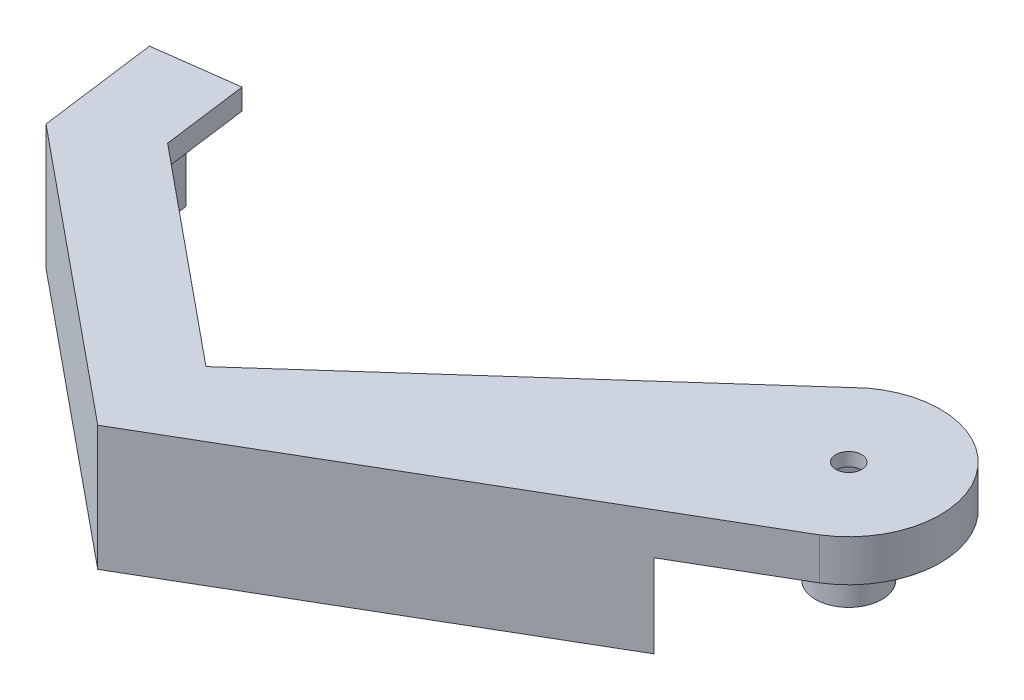
from build123d import *

# Parameters (mm, degrees)
SKETCH1_R           = 10.33488188
BOSS_EXTRUDE1_DEPTH = 4
MOVE_FACE1_BY       = 3
BOSS_EXTRUDE3_DEPTH = 5
SKETCH6_R           = 6.3
BOSS_EXTRUDE4_DEPTH = 0.3
MOVE_FACE2_BY       = 1
BOSS_EXTRUDE5_DEPTH = 10
CUT_EXTRUDE3_START  = -2.5
CUT_EXTRUDE3_DEPTH  = 2.5
SKETCH11_W          = 38.556462408
SKETCH11_H          = 5
CUT_EXTRUDE4_DEPTH  = 22
SKETCH12_W          = 43.724305207
SKETCH12_H          = 11.25792899
CUT_EXTRUDE5_DEPTH  = 23
SKETCH13_R          = 4
BOSS_EXTRUDE6_DEPTH = 7
SKETCH14_R          = 1.55
CUT_EXTRUDE6_DEPTH  = 14.3
CUT_EXTRUDE7_DEPTH  = 2.5


with BuildPart() as part:
    # Sketch1 → Boss-Extrude1 (new body)
    with BuildSketch(Plane(origin=(0, 0, 0), x_dir=(1, 0, 0), z_dir=(0, 1, 0))):
        Circle(SKETCH1_R)
    extrude(amount=BOSS_EXTRUDE1_DEPTH)

    # Move Face1: a face moved inward by 3.0
    extrude(part.faces().sort_by_distance((0, 0, 0))[0], amount=MOVE_FACE1_BY, dir=(0, 1, 0), mode=Mode.SUBTRACT)

    # Sketch5 → Boss-Extrude3 (add)
    with BuildSketch(Plane.XZ.offset(-3)):
        with BuildLine():
            Line((-75.458239849, -2.567544533), (-74.096914155, 7.742973997))
            Line((-74.096914155, 7.742973997), (-48.544654941, 28.683445601))
            Line((-48.544654941, 28.683445601), (-6.542555498, -8.842791841))
            ThreePointArc((-6.542555498, -8.842791841), (9.276836304, -5.911032751), (5.250823636, 9.665860083))
            Line((5.250823636, 9.665860083), (-48.948307508, 41.281704816))
            Line((-48.948307508, 41.281704816), (-83.396048293, 13.051248491))
            Line((-83.396048293, 13.051248491), (-85.286900385, -1.269839857))
            Line((-85.286900385, -1.269839857), (-75.458239849, -2.567544533))
        make_face()
    extrude(amount=BOSS_EXTRUDE3_DEPTH)

    # Sketch6 → Boss-Extrude4 (add)
    with BuildSketch(Plane.XZ.offset(2)):
        Circle(SKETCH6_R)
    extrude(amount=BOSS_EXTRUDE4_DEPTH)

    # Move Face2: a face moved inward by 1.0
    extrude(part.faces().sort_by_distance((0, 4, 0))[0], amount=MOVE_FACE2_BY, dir=(0, -1, 0), mode=Mode.SUBTRACT)

    # Sketch8 → Boss-Extrude5 (add)
    with BuildSketch(Plane.XZ.offset(2)):
        with BuildLine():
            Line((-85.286900385, -1.269839857), (-81.401644859, -1.782820669))
            Line((-81.401644859, -1.782820669), (-79.667167658, 11.353902903))
            Line((-79.667167658, 11.353902903), (-48.948307508, 36.528483878))
            Line((-48.948307508, 36.528483878), (-12.814011549, 12.57544193))
            ThreePointArc((-12.814011549, 12.57544193), (-9.977104961, 14.926419809), (-6.720020018, 16.648782619))
            Line((-6.720020018, 16.648782619), (-48.948307508, 41.281704816))
            Line((-48.948307508, 41.281704816), (-83.396048293, 13.051248491))
            Line((-83.396048293, 13.051248491), (-85.286900385, -1.269839857))
        make_face()
    extrude(amount=BOSS_EXTRUDE5_DEPTH)

    # Sketch9 → Cut-Extrude3 (cut)
    with BuildSketch(Plane.XZ.offset(2).offset(CUT_EXTRUDE3_START)):
        with BuildLine():
            Line((-17.906010426, 1.309741328), (-75.458239849, -2.567544533))
            Line((-75.458239849, -2.567544533), (-81.401644859, -1.782820669))
            Line((-81.401644859, -1.782820669), (-79.667167658, 11.353902903))
            Line((-79.667167658, 11.353902903), (-48.948307508, 36.528483878))
            Line((-48.948307508, 36.528483878), (-12.814011549, 12.57544193))
            ThreePointArc((-12.814011549, 12.57544193), (-16.360285451, 7.394707004), (-17.906010426, 1.309741328))
        make_face()
    extrude(amount=CUT_EXTRUDE3_DEPTH, mode=Mode.SUBTRACT)

    # Sketch10 → Revolve3 (revolve)
    with BuildSketch(Plane(origin=(0, 0, 0), x_dir=(-0.8335005239033985, 0, 0.5525186663387585), z_dir=(-0.5525186663387585, 0, -0.8335005239033985))):
        with BuildLine():
            Line((17.953847268, 1.010036729), (20.953847268, 1.010036729))
            ThreePointArc((20.953847268, 1.010036729), (20.075167612, -1.111283615), (17.953847268, -1.989963271))
            Line((17.953847268, -1.989963271), (17.953847268, 1.010036729))
        make_face()
    revolve(axis=Axis((0, -2, 0), (0, 1, 0)))

    # Sketch11 → Cut-Extrude4 (cut)
    with BuildSketch(Plane(origin=(-7.297700024, 0, -8.168117643), x_dir=(-0.7457227293695607, 0, 0.6662564152798927), z_dir=(-0.6662564152798927, 0, -0.7457227293695607))):
        with Locations((0.563178153, 0.5)):
            Rectangle(SKETCH11_W, SKETCH11_H)
    extrude(amount=CUT_EXTRUDE4_DEPTH, mode=Mode.SUBTRACT)

    # Sketch12 → Cut-Extrude5 (cut)
    with BuildSketch(Plane(origin=(5.539973034, 0, 9.497191282), x_dir=(0.863781086549818, 0, -0.5038672786744701), z_dir=(0.5038672786744701, 0, 0.863781086549818))):
        with Locations((-0.276332753, -2.628964495)):
            Rectangle(SKETCH12_W, SKETCH12_H)
    extrude(amount=CUT_EXTRUDE5_DEPTH, mode=Mode.SUBTRACT)


with BuildPart() as cut_extrude5_kept_piece:
    # of the separate pieces the step leaves, the one the design keeps (cut_extrude5_pieces_kept)
    add(part.part.solids().sort_by_distance((-75.458239849, 3, -2.567544533))[0])

    # Sketch13 → Boss-Extrude6 (add)
    with BuildSketch(Plane.XZ.offset(2.3)):
        Circle(SKETCH13_R)
    extrude(amount=BOSS_EXTRUDE6_DEPTH)

    # Sketch14 → Cut-Extrude6 (cut)
    with BuildSketch(Plane.XZ.offset(9.3)):
        Circle(SKETCH14_R)
    extrude(amount=-CUT_EXTRUDE6_DEPTH, mode=Mode.SUBTRACT)

    # Sketch15 → Cut-Extrude7 (cut)
    with BuildSketch(Plane(origin=(0, -1.1, 0), x_dir=(-1, 0, 0), z_dir=(0, -1, 0))):
        Polygon((2.070374006, -2.777328118), (3.440423708, 0.404332426), (1.370049701, 3.181660544), (-2.070374006, 2.777328118), (-3.440423708, -0.404332426), (-1.370049701, -3.181660544), align=None)
    extrude(amount=-CUT_EXTRUDE7_DEPTH, mode=Mode.SUBTRACT)


solid = cut_extrude5_kept_piece.part
